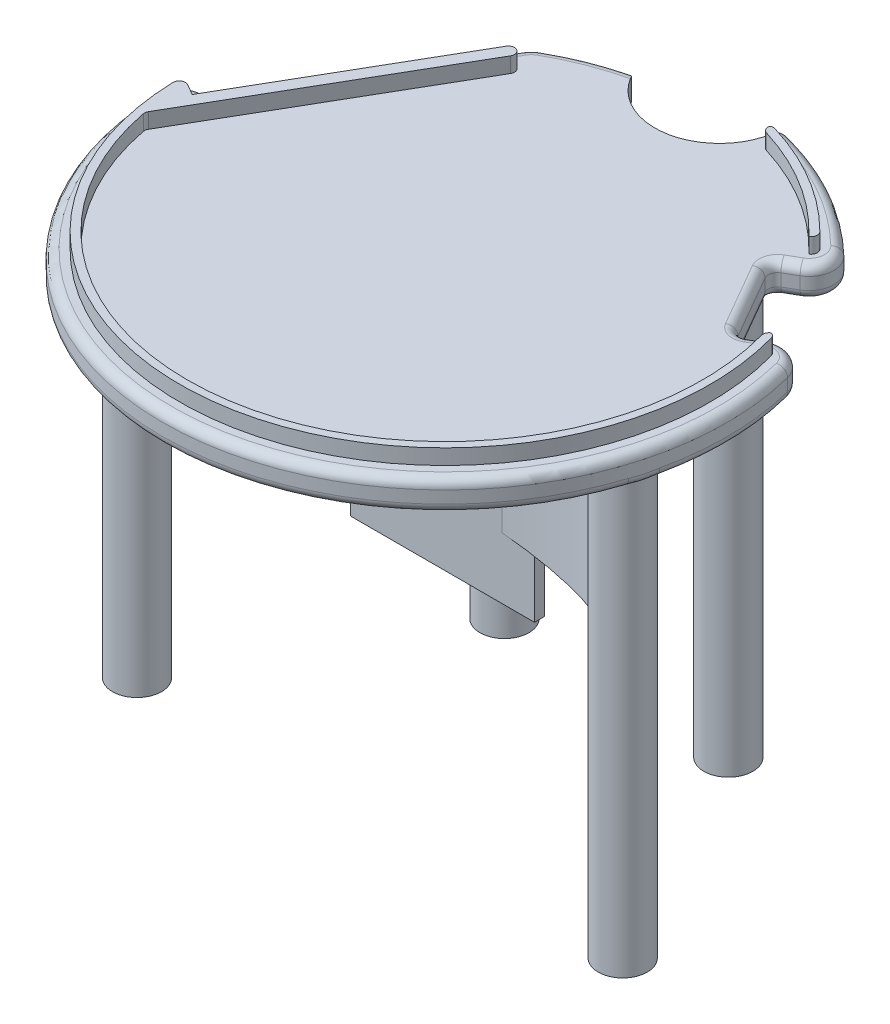
from build123d import *

# Parameters (mm, degrees)
BOSS_EXTRUDE1_DEPTH                  = 6.35
SKETCH9_R                            = 5.080000000000005
SKETCH9_R_2                          = 5.080000000000002
BOSS_EXTRUDE5_DEPTH                  = 88.89999999999999
BOSS_EXTRUDE6_DEPTH                  = 3.175
BOSS_EXTRUDE7_DEPTH                  = 38.1
FILLET14_R                           = 5.08
FILLET16_R                           = 1.9049999999999998
FILLET17_R                           = 1.27
FILLET18_START                       = 6.35
FILLET18_DEPTH                       = 4.65
FILLET19_START                       = 6.35
FILLET19_DEPTH                       = 4.65
BOSS_EXTRUDE8_START                  = 0.508
BOSS_EXTRUDE8_DEPTH                  = 2.032
TAPPED_HOLE_FOR_4_40_HELICOIL2_D     = 3.048
TAPPED_HOLE_FOR_4_40_HELICOIL2_DEPTH = 8.128
TAPPED_HOLE_FOR_4_40_HELICOIL2_TIP   = 0.9157115833980018


with BuildPart() as part:
    # Sketch1 → Boss-Extrude1 (new body)
    with BuildSketch(Plane(origin=(0, 0, 0), x_dir=(1, 0, 0), z_dir=(0, 1, 0))):
        with BuildLine():
            Line((-51.72800047370612, 3.368475005594249), (-32.253592818708114, 37.09913851135874))
            Line((-32.253592818708114, 37.09913851135874), (-27.374593601770787, 45.30393786999394))
            ThreePointArc((-27.374593601770787, 45.30393786999394), (-20.06656456082034, 48.98109990717654), (-12.27919224001569, 51.48821806319499))
            ThreePointArc((-12.27919224001569, 51.48821806319499), (2.744877849525799, 43.74226078290458), (13.403434591122629, 56.86162450336374))
            ThreePointArc((13.403434591122629, 56.86162450336374), (30.90600933787068, 49.5753465626564), (45.153710605874416, 37.06802960127476))
            Line((45.153710605874416, 37.06802960127476), (35.49209281870813, 31.489891971046966))
            Line((35.49209281870813, 31.489891971046966), (45.017092818708214, 14.99210802895345))
            Line((45.017092818708214, 14.99210802895345), (54.62433002243948, 20.71422143358487))
            ThreePointArc((54.62433002243948, 20.71422143358487), (7.06676901636694, -57.99100943826799), (-58.00033588313994, 6.9898095426785245))
            Line((-58.00033588313994, 6.9898095426785245), (-51.72800047370612, 3.368475005594249))
        make_face()
    extrude(amount=BOSS_EXTRUDE1_DEPTH)

    # Sketch9 → Boss-Extrude5 (add)
    with BuildSketch(Plane(origin=(0, 0, 0), x_dir=(1, 0, 0), z_dir=(0, 1, 0))):
        with Locations(Location((-50.29575777487171, -13.476707678488491, 0), (0, 0, 270))):
            Circle(SKETCH9_R)
        with Locations(Location((50.295757774871724, -13.476707678488456, 0), (0, 0, 270))):
            Circle(SKETCH9_R)
        with Locations(Location((-22.825821957479846, 35.148683502592675, 0), (0, 0, 270))):
            Circle(SKETCH9_R_2)
        with Locations(Location((25.222067620302386, 33.470814226082005, 0), (0, 0, 270))):
            Circle(SKETCH9_R)
    extrude(amount=-BOSS_EXTRUDE5_DEPTH)

    # Sketch11 → Boss-Extrude6 (add)
    with BuildSketch(Plane(origin=(0, 6.35, 0), x_dir=(1, 0, 0), z_dir=(0, 1, 0))):
        with BuildLine():
            Line((-50.72007651861668, -1.6128592124242613), (-54.89584043662567, 0.7980192097108443))
            ThreePointArc((-54.89584043662567, 0.7980192097108443), (7.654945750672077, -54.365356040927395), (52.54104281304024, 15.925732385696424))
            Line((52.54104281304024, 15.925732385696424), (51.13454877418699, 15.088018251800504))
            ThreePointArc((51.13454877418699, 15.088018251800504), (12.383825031049634, -51.85586997348247), (-52.434288483817596, -9.645504875441516))
            Line((-52.434288483817596, -9.645504875441516), (-24.059325186663663, 39.38204671455064))
            Line((-24.059325186663663, 39.38204671455064), (-26.257690860152884, 40.654362856719835))
            Line((-26.257690860152884, 40.654362856719835), (-50.72007651861668, -1.6128592124242613))
        make_face()
        with BuildLine():
            Line((38.58255986400612, 36.79370119255138), (39.99613553620174, 37.60982948741344))
            ThreePointArc((39.99613553620174, 37.60982948741344), (28.474172329726393, 46.940511736021556), (14.875659709365976, 52.84794111518138))
            Line((14.875659709365976, 52.84794111518138), (14.445506531330636, 51.319759490469714))
            ThreePointArc((14.445506531330636, 51.319759490469714), (27.490826630454226, 45.67980762088082), (38.58255986400612, 36.79370119255138))
        make_face()
    extrude(amount=BOSS_EXTRUDE6_DEPTH)

    # Sketch2 → Boss-Extrude7 (add)
    with BuildSketch(Plane(origin=(0, 0, 0), x_dir=(1, 0, 0), z_dir=(0, 1, 0))):
        with BuildLine():
            Line((-47.247757774871715, -13.476707678488491), (-45.21575777487172, -13.476707678488491))
            add(Edge.make_bspline(
                [(45.21575777487172, -13.476707678488491), (45.21575777487172, 1.066e-14), (2.77e-15, 1.421e-14), (-45.21575777487171, 1.421e-14), (-45.21575777487172, -13.476707678488491)],
                knots=[0, 0, 0, 1.5707963267948966, 1.5707963267948966, 3.141592653589793, 3.141592653589793, 3.141592653589793], degree=2, weights=[1, 0.7071067811865476, 1, 0.7071067811865476, 1]))
            Line((45.21575777487172, -13.476707678488491), (47.247757774871715, -13.476707678488491))
            add(Edge.make_bspline(
                [(47.247757774871715, -13.476707678488491), (47.247757774871715, 2.0319999999999965), (2.89e-15, 2.032), (-47.24775777487171, 2.032), (-47.247757774871715, -13.476707678488491)],
                knots=[0, 0, 0, 1.5707963267948966, 1.5707963267948966, 3.141592653589793, 3.141592653589793, 3.141592653589793], degree=2, weights=[1, 0.7071067811865476, 1, 0.7071067811865476, 1]))
        make_face()
    extrude(amount=-BOSS_EXTRUDE7_DEPTH)

    # Fillet14
    # the kernel refuses this fillet: 5.08 mm, written as the material it takes off along each edge
    with BuildSketch(Plane(origin=(45.15371060587442, -16.579017685538727, -37.06802960127476), x_dir=(-0.8660254037844366, 0, 0.5000000000000037), z_dir=(0, 1, 0))) as fillet14_piece_1:
        with BuildLine():
            CenterArc((6.3367199721405845, -5.079999999999999), FILLET14_R, 90.00000000000004, 105.89108211862981)
            Line((1.450857563729668, -6.470952380952387), (1.353140315561451, -6.498771428571434))
            ThreePointArc((1.353140315561451, -6.498771428571434), (0.5343964239754567, -3.2783077127999745), (-0.10024047871383523, -0.01656521739130311))
            Line((-0.10024047871383523, -0.01656521739130311), (-1.35e-15, 0.10160000000000173))
            Line((-1.35e-15, 0.10160000000000173), (6.33671997214058, 0.10160000000000205))
            Line((6.33671997214058, 0.10160000000000205), (6.336719972140582, 5e-16))
        make_face()
    extrude(amount=39.508035371077455, mode=Mode.SUBTRACT)
    with BuildSketch(Plane(origin=(-58.00033588313994, -21.483083714092373, -6.989809542678527), x_dir=(0.8660254037844368, 0, 0.5000000000000033), z_dir=(0, 1, 0))) as fillet14_piece_2:
        with BuildLine():
            CenterArc((8.275866800739875, -4.973821715522956), FILLET14_R, 101.73499699138236, 109.82872506580324)
            Line((3.9474094413657017, -7.6329300036675995), (3.860840294178216, -7.686112169430493))
            ThreePointArc((3.860840294178216, -7.686112169430493), (1.7429235241089065, -3.935814697665938), (-0.09343420708550909, -0.03990750488694842))
            Line((-0.09343420708550909, -0.03990750488694842), (1.84e-15, 0.10160000000000095))
            ThreePointArc((1.84e-15, 0.10160000000000095), (3.6213345370842522, 0.10159999999999521), (7.222005119637067, 0.09947643431045891))
            Line((7.222005119637067, 0.09947643431045891), (7.242669074168494, -4.4e-16))
        make_face()
    extrude(amount=49.31616742818475, mode=Mode.SUBTRACT)
    with BuildSketch(Plane(origin=(54.62433002243948, -16.777729909598907, -20.714221433584868), x_dir=(0.30028234042018037, 0, 0.9538503635433488), z_dir=(0, 1, 0))) as fillet14_piece_3:
        with BuildLine():
            CenterArc((6.419305356716113, -5.071613212371716), FILLET14_R, 86.70721507556486, 106.59643991625649)
            Line((1.4756312433391734, -6.240581244751875), (1.376757761071635, -6.263960605399478))
            Line((1.376757761071635, -6.263960605399478), (-0.09887348226753818, -0.02337936064760279))
            Line((-0.09887348226753818, -0.02337936064760279), (-0.00583573214247033, 0.10143226424743101))
            ThreePointArc((-0.00583573214247033, 0.10143226424743101), (3.355545981919779, 0.1980480577252392), (6.716927695982033, 0.10143226424743634))
            Line((6.716927695982033, 0.10143226424743634), (6.7110919638395625, 1.5e-16))
        make_face()
    extrude(amount=39.905459819197816, mode=Mode.SUBTRACT)
    with BuildSketch(Plane(origin=(-27.37459360177079, -3.4350951623356023, -45.303937869993945), x_dir=(-0.5111117579176493, 0, 0.8595142645228934), z_dir=(0, 1, 0))) as fillet14_piece_4:
        with BuildLine():
            CenterArc((1.306440801825986, 5.08), FILLET14_R, 240.3927416696962, 29.607258330303694)
            Line((-1.2033434179666247, 0.663283666559515), (-1.2535391023624756, 0.5749493398907073))
            ThreePointArc((-1.2535391023624756, 0.5749493398907073), (-0.6528689723588473, 0.23875866276476213), (-0.04788594195617468, -0.08960745818831127))
            Line((-0.04788594195617468, -0.08960745818831127), (-1.94e-15, -0.10159999999999994))
            Line((-1.94e-15, -0.10159999999999994), (1.3064408018259714, -0.10159999999999986))
            Line((1.3064408018259714, -0.10159999999999986), (1.3064408018259734, 2e-17))
        make_face()
    extrude(amount=13.220190324671204, mode=Mode.SUBTRACT)

    # Fillet16
    fillet16_edges = [part.edges().sort_by_distance(p)[0] for p in [
        (28.04238922666604, 0, -51.24959323214382),
        (8.001988007551688, 0, 57.86937521631773),
        (53.66004419284633, 0, -17.76087784118472),
        (-56.352470503822225, 0, -2.6201221549695797),
        (42.16749386269766, 0, -37.67519019491397),
        (-27.233989522734753, 0, -45.21047850689065),
        (8.001988007551688, 6.35, 57.86937521631773),
        (28.04238922666604, 6.35, -51.24959323214382),
        (53.66004419284633, 6.349999999999998, -17.76087784118472),
        (-56.352470503822225, 6.349999999999998, -2.6201221549695797),
        (42.16749386269766, 6.350000000000001, -37.67519019491397),
        (-27.233989522734753, 6.349999999999999, -45.21047850689065),
        (37.57902147602002, 0, -32.69478079312554),
        (40.254592818708176, 0, -23.241000000000206),
        (47.06597407773296, 0, -16.212430861433347),
        (-30.147961837657782, 6.35, -40.64008593821423),
        (-41.990796646207116, 0, -20.233806758476494),
        (-30.147961837657782, 0, -40.64008593821423),
        (-19.429137171021097, 0, -49.23742265980245),
        (2.744877849525799, 0, -43.74226078290458),
        (-41.990796646207116, 6.35, -20.233806758476494),
        (13.403434591122629, 3.175, -56.86162450336374),
        (35.49209281870813, 3.175, -31.489891971046966),
        (45.017092818708214, 3.175, -14.99210802895345),
        (-12.27919224001569, 3.175, -51.48821806319499),
        (47.06597407773296, 6.35, -16.212430861433347),
        (40.254592818708176, 6.35, -23.241000000000206),
        (37.57902147602002, 6.35, -32.69478079312554),
        (-19.429137171021097, 6.35, -49.23742265980245),
    ]]
    fillet(fillet16_edges, radius=FILLET16_R)

    # Fillet17
    fillet17_edges = [part.edges().sort_by_distance(p)[0] for p in [
        (-24.059325186663663, 7.9375, -39.38204671455064),
        (-54.895840436625676, 7.9375, -0.7980192097108444),
        (51.134548774186996, 7.9375, -15.088018251800506),
        (-52.4342884838176, 7.9375, 9.645504875441514),
    ]]
    fillet(fillet17_edges, radius=FILLET17_R)

    # Fillet18: read off the stored shape, not the designer's step
    # Fillet18 outline → Fillet18 (cut)
    with BuildSketch(Plane(origin=(0, 0, 0), x_dir=(1, 0, 0), z_dir=(0, 1, 0)).offset(FILLET18_START)):
        with BuildLine():
            Line((-26.25769086, 40.654362857), (-26.893848931, 39.55518002))
            ThreePointArc((-26.893848931, 39.55518002), (-26.122074046, 40.146093272), (-25.158508023, 40.018204786))
            Line((-25.158508023, 40.018204786), (-26.25769086, 40.654362857))
        make_face()
        with BuildLine():
            ThreePointArc((14.445506531, 51.31975949), (15.041594109, 51.148224013), (15.635645663, 50.969765133))
            ThreePointArc((15.635645663, 50.969765133), (14.893198505, 51.575738783), (14.785610727, 52.52802903))
            Line((14.785610727, 52.52802903), (14.445506531, 51.31975949))
        make_face()
        with BuildLine():
            ThreePointArc((38.849703366, 38.792920492), (39.210095509, 37.7293232), (38.586021235, 36.795699616))
            Line((38.586021235, 36.795699616), (39.996135536, 37.609829487))
            ThreePointArc((39.996135536, 37.609829487), (39.427357306, 38.205675334), (38.849703366, 38.792920492))
        make_face()
        with BuildLine():
            ThreePointArc((51.973910084, 15.587945598), (52.558065388, 15.26651958), (52.898887021, 14.693463983))
            ThreePointArc((52.898887021, 14.693463983), (52.723565151, 15.310643673), (52.541042813, 15.925732386))
            Line((52.541042813, 15.925732386), (51.973910084, 15.587945598))
        make_face()
    extrude(amount=FILLET18_DEPTH, mode=Mode.SUBTRACT)

    # Fillet19: read off the stored shape, not the designer's step
    # Fillet19 outline → Fillet19 (cut)
    with BuildSketch(Plane(origin=(0, 0, 0), x_dir=(1, 0, 0), z_dir=(0, 1, 0)).offset(FILLET19_START)):
        with BuildLine():
            ThreePointArc((14.785610727, 52.52802903), (15.240713213, 52.654434766), (15.710532865, 52.605791402))
            ThreePointArc((15.710532865, 52.605791402), (15.293575552, 52.728518647), (14.875659709, 52.847941115))
            Line((14.875659709, 52.847941115), (14.785610727, 52.52802903))
        make_face()
        with BuildLine():
            Line((38.582559864, 36.793701193), (38.586021235, 36.795699616))
            ThreePointArc((38.586021235, 36.795699616), (38.550078377, 36.829138082), (38.515454698, 36.863940681))
            ThreePointArc((38.515454698, 36.863940681), (38.549023279, 36.828836221), (38.582559864, 36.793701193))
        make_face()
    extrude(amount=FILLET19_DEPTH, mode=Mode.SUBTRACT)

    # Sketch12 → Boss-Extrude8 (add)
    with BuildSketch(Plane.XY.offset(BOSS_EXTRUDE8_START)):
        Polygon((-19.05, 0), (19.05, 4.77e-15), (19.050000000000008, -50.79999999999999), (-19.049999999999994, -50.8), align=None)
    extrude(amount=-BOSS_EXTRUDE8_DEPTH)

    # Tapped Hole for #4-40 Helicoil2
    with Locations(Plane(origin=(0, -88.89999999999999, 0), x_dir=(-1, 0, 0), z_dir=(0, -1, 0))):
        with Locations((50.295757775, -13.476707678), (22.825821957, 35.148683503), (-25.22206762, 33.470814226), (-50.295757775, -13.476707678)):
            Hole(TAPPED_HOLE_FOR_4_40_HELICOIL2_D / 2, depth=TAPPED_HOLE_FOR_4_40_HELICOIL2_DEPTH)
            with Locations((0, 0, -(TAPPED_HOLE_FOR_4_40_HELICOIL2_DEPTH + TAPPED_HOLE_FOR_4_40_HELICOIL2_TIP / 2))):  # 118° drill point
                Cone(0, TAPPED_HOLE_FOR_4_40_HELICOIL2_D / 2, TAPPED_HOLE_FOR_4_40_HELICOIL2_TIP, mode=Mode.SUBTRACT)


with BuildPart() as body_2:
    # Split2: the piece on the far side of the plane
    add(part.part)
    split(bisect_by=Plane(origin=(0, 0, 0), x_dir=(0, 0, -1), z_dir=(0, -1, 0)), keep=Keep.BOTTOM)


with BuildPart() as part_1:
    add(part.part)

    # Split2
    split(bisect_by=Plane(origin=(0, 0, 0), x_dir=(0, 0, -1), z_dir=(0, -1, 0)), keep=Keep.TOP)


solid = Compound([body_2.part, part_1.part])
